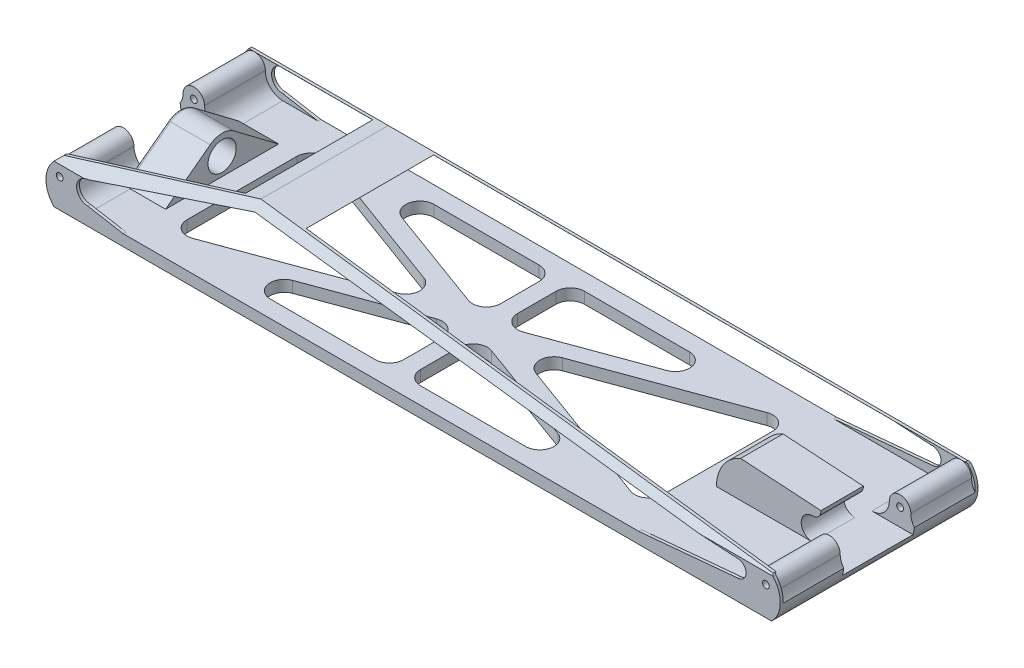
from build123d import *
from build123d.topology import SkipClean

# Parameters (mm, degrees)
SKETCH1_R                = 1.2
BOSS_EXTRUDE1_DEPTH      = 35
SKETCH2_W                = 25
SKETCH2_H                = 10
CUT_EXTRUDE1_DEPTH       = 273.618781451
BOSS_EXTRUDE2_DEPTH      = 7.5
SKETCH4_W                = 17.5
SKETCH4_H                = 25
CUT_EXTRUDE2_DEPTH       = 273.618781451
BOSS_EXTRUDE3_START      = 17.5
BOSS_EXTRUDE3_DEPTH      = 15
CUT_EXTRUDE7_DEPTH       = 273.618781451
FILLET8_R                = 5
FILLET9_R                = 1
BOSS_EXTRUDE4_DEPTH      = 270
CUT_EXTRUDE8_DEPTH       = 274.55025464
CUT_EXTRUDE8_DEPTH_BACK  = 274.55025464
CUT_EXTRUDE11_DEPTH      = 274.55025464
CUT_EXTRUDE11_DEPTH_BACK = 274.55025464
CUT_EXTRUDE9_DEPTH       = 276.428741807
CUT_EXTRUDE9_DEPTH_BACK  = 276.428741807
SKETCH19_R               = 1.2
CUT_EXTRUDE10_DEPTH      = 276.428741807
CUT_EXTRUDE10_DEPTH_BACK = 276.428741807
SKETCH21_R               = 1.2
CHAMFER1_SIZE            = 8
CHAMFER1_SIZE_2          = 9.946012797
CHAMFER1_SIZE_3          = 8.548617227
CHAMFER2_SIZE            = 8
CUT_EXTRUDE13_START      = -10.925683
CUT_EXTRUDE13_DEPTH      = 10.925683
CUT_EXTRUDE14_DEPTH      = 15
FILLET10_R               = 10


# Some blends are built 0.0001 mm under size
with BuildPart() as part:
    # Sketch1 → Boss-Extrude1 (new, symmetric)
    with BuildSketch(Plane.XY):
        with BuildLine():
            Line((0, 0), (270, 0))
            Line((270, 0), (270, 4))
            ThreePointArc((270, 4), (265.615937957, 5.815937957), (263.8, 10.2))
            ThreePointArc((263.8, 10.2), (260, 14), (256.2, 10.2))
            ThreePointArc((256.2, 10.2), (254.384062043, 5.815937957), (250, 4))
            Line((250, 4), (20, 4))
            ThreePointArc((20, 4), (15.615937957, 5.815937957), (13.8, 10.2))
            ThreePointArc((13.8, 10.2), (10, 14), (6.2, 10.2))
            ThreePointArc((6.2, 10.2), (4.384062043, 5.815937957), (0, 4))
            Line((0, 4), (0, 0))
        make_face()
        with Locations((10, 10.2)):
            Circle(SKETCH1_R, mode=Mode.SUBTRACT)
        with Locations((260, 10.2)):
            Circle(SKETCH1_R, mode=Mode.SUBTRACT)
    extrude(amount=BOSS_EXTRUDE1_DEPTH, both=True)

    # Sketch2 → Cut-Extrude1 (cut, through all)
    with BuildSketch(Plane(origin=(0, 0, 0), x_dir=(0, 0, -1), z_dir=(1, 0, 0))):
        with Locations((0, 9)):
            Rectangle(SKETCH2_W, SKETCH2_H)
    extrude(amount=CUT_EXTRUDE1_DEPTH, mode=Mode.SUBTRACT)

    # Sketch3 → Boss-Extrude2 (add, symmetric)
    with BuildSketch(Plane.XY):
        with BuildLine():
            Line((249, 18), (229, 18))
            ThreePointArc((229, 18), (219.100505063, 13.899494937), (215, 4))
            Line((215, 4), (249, 4))
            ThreePointArc((249, 4), (245, 8), (249, 12))
            ThreePointArc((249, 12), (252, 15), (249, 18))
        make_face()
    extrude(amount=BOSS_EXTRUDE2_DEPTH, both=True)

    # Sketch4 → Cut-Extrude2 (cut, through all)
    with BuildSketch(Plane(origin=(0, 4, 0), x_dir=(1, 0, 0), z_dir=(0, 1, 0))):
        with Locations((8.75, 0)):
            Rectangle(SKETCH4_W, SKETCH4_H)
    extrude(amount=-CUT_EXTRUDE2_DEPTH, mode=Mode.SUBTRACT)

    # Sketch6 → Boss-Extrude3 (add)
    with BuildSketch(Plane(origin=(0, 0, 0), x_dir=(0, 0, -1), z_dir=(1, 0, 0)).offset(BOSS_EXTRUDE3_START)):
        with BuildLine():
            Line((-15.013439976, 4), (-3.05122926, 4))
            ThreePointArc((-3.05122926, 4), (-5.860894332, 6.472478918), (-6.995136661, 10.039110964))
            Line((-6.995136661, 10.039110964), (-15.013439976, 4))
        make_face()
        with BuildLine():
            Line((-3.05122926, 4), (0, 4))
            Line((0, 4), (0, 5.3))
            ThreePointArc((0, 5.3), (-5, 10.3), (0, 15.3))
            Line((0, 15.3), (0, 17.3))
            ThreePointArc((0, 17.3), (-2.220310268, 16.938540677), (-4.211320008, 15.89149209))
            Line((-4.211320008, 15.89149209), (-20, 4))
            Line((-20, 4), (-15.013439976, 4))
            Line((-15.013439976, 4), (-6.995136661, 10.039110964))
            ThreePointArc((-6.995136661, 10.039110964), (-5.860894332, 6.472478918), (-3.05122926, 4))
        make_face()
        with BuildLine():
            Line((0, 5.3), (0, 4))
            Line((0, 4), (3.05122926, 4))
            ThreePointArc((3.05122926, 4), (5.860894332, 6.472478918), (6.995136661, 10.039110964))
            Line((6.995136661, 10.039110964), (15.013439976, 4))
            Line((15.013439976, 4), (20, 4))
            Line((20, 4), (4.211320008, 15.89149209))
            ThreePointArc((4.211320008, 15.89149209), (2.220310268, 16.938540677), (0, 17.3))
            Line((0, 17.3), (0, 15.3))
            ThreePointArc((0, 15.3), (3.535533906, 13.835533906), (5, 10.3))
            ThreePointArc((5, 10.3), (3.535533906, 6.764466094), (0, 5.3))
        make_face()
        with BuildLine():
            ThreePointArc((6.995136661, 10.039110964), (5.860894332, 6.472478918), (3.05122926, 4))
            Line((3.05122926, 4), (15.013439976, 4))
            Line((15.013439976, 4), (6.995136661, 10.039110964))
        make_face()
    extrude(amount=BOSS_EXTRUDE3_DEPTH)

    # Sketch12 → Cut-Extrude7 (cut, through all)
    with BuildSketch(Plane(origin=(0, 4, 0), x_dir=(1, 0, 0), z_dir=(0, 1, 0))):
        Polygon((50.365488341, -29), (120.75, -29), (120.75, -3.195266211), align=None)
        Polygon((39.5, -26.593029124), (112.034651346, 0), (39.5, 26.593029124), align=None)
        Polygon((120.75, 3.195266211), (120.75, 29), (50.365488341, 29), align=None)
        Polygon((126.75, 29), (126.75, 3.195266211), (197.134511659, 29), align=None)
        Polygon((135.465348654, 0), (208, -26.593029124), (208, 26.593029124), align=None)
        Polygon((126.75, -29), (197.134511659, -29), (126.75, -3.195266211), align=None)
    extrude(amount=-CUT_EXTRUDE7_DEPTH, mode=Mode.SUBTRACT)

    # Fillet8
    fillet8_edges = [part.edges().sort_by_distance(p)[0] for p in [
        (50.365488341, 2, -29),
        (120.75, 2, -29),
        (120.75, 2, -3.195266211),
        (39.5, 2, 26.593029124),
        (39.5, 2, -26.593029124),
        (112.034651346, 2, 0),
        (208, 2, 26.593029124),
        (135.465348654, 2, 0),
        (208, 2, -26.593029124),
        (126.75, 2, -29),
        (197.134511659, 2, -29),
        (126.75, 2, -3.195266211),
        (126.75, 2, 29),
        (126.75, 2, 3.195266211),
        (197.134511659, 2, 29),
        (50.365488341, 2, 29),
        (120.75, 2, 3.195266211),
        (120.75, 2, 29),
    ]]
    fillet(fillet8_edges, radius=FILLET8_R)

    # Fillet9
    fillet9_edges = [part.edges().sort_by_distance(p)[0] for p in [
        (17.5, 10.208934454, -11.756217096),
        (17.5, 10.208934454, 11.756217096),
        (17.5, 17.3, 0),
    ]]
    fillet(fillet9_edges, radius=FILLET9_R)

    # Sketch14 → Boss-Extrude4 (add, through all)
    with BuildSketch(Plane(origin=(0, 0, 0), x_dir=(0, 0, -1), z_dir=(1, 0, 0))):
        Polygon((-35, 14), (-35, 0), (-34, 0), (-34, 14), (-22.54020479, 25.546973716), (22.54020479, 25.546973716), (34, 14), (34, 0), (35, 0), (35, 14), (22.54020479, 26.546973716), (-22.54020479, 26.546973716), align=None)
    extrude(amount=BOSS_EXTRUDE4_DEPTH)

    # Sketch16 → Cut-Extrude8 (cut, two sides: drawn at the far end of the back side and taken through both)
    with BuildSketch(Plane.XY.offset(-CUT_EXTRUDE8_DEPTH_BACK)):
        Polygon((0, 26.546973716), (68.792545546, 26.546973716), (0, 14), align=None)
        Polygon((68.792545546, 26.546973716), (270, 14), (270, 26.546973716), align=None)
    extrude(amount=CUT_EXTRUDE8_DEPTH + CUT_EXTRUDE8_DEPTH_BACK, mode=Mode.SUBTRACT)

    # Sketch24 → Cut-Extrude11 (cut, two sides: drawn at the far end of the back side and taken through both)
    with BuildSketch(Plane.XY.offset(-CUT_EXTRUDE11_DEPTH_BACK)):
        with BuildLine():
            Line((32.5, 4), (32.5, 16))
            Line((32.5, 16), (69.185468124, 24.001191397))
            Line((69.185468124, 24.001191397), (218.863454759, 13.656627288))
            ThreePointArc((218.863454759, 13.656627288), (216.001699469, 9.200402226), (215, 4))
            Line((215, 4), (32.5, 4))
        make_face()
    extrude(amount=CUT_EXTRUDE11_DEPTH + CUT_EXTRUDE11_DEPTH_BACK, mode=Mode.SUBTRACT)

    # Sketch19 → Cut-Extrude9 (cut, two sides: drawn at the far end of the back side and taken through both)
    with SkipClean():  # the faces are left unmerged after this step: merging them gives an invalid solid
        with BuildSketch(Plane(origin=(0, 0, 12.5), x_dir=(-1, 0, 0), z_dir=(0, 0, -1)).offset(-CUT_EXTRUDE9_DEPTH_BACK)):
            with Locations((-260, 10.2)):
                Circle(SKETCH19_R)
        extrude(amount=CUT_EXTRUDE9_DEPTH + CUT_EXTRUDE9_DEPTH_BACK, mode=Mode.SUBTRACT)
    add(part.part.scale(1), mode=Mode.REPLACE)  # the faces are merged on a copy

    # Sketch21 → Cut-Extrude10 (cut, two sides: drawn at the far end of the back side and taken through both)
    with BuildSketch(Plane.XY.offset(-12.5).offset(-CUT_EXTRUDE10_DEPTH_BACK)):
        with Locations(Location((10, 10.2, 0), (0, 0, 180))):
            Circle(SKETCH21_R)
    extrude(amount=CUT_EXTRUDE10_DEPTH + CUT_EXTRUDE10_DEPTH_BACK, mode=Mode.SUBTRACT)

    # Chamfer1
    # the kernel refuses this chamfer: 9.946012797, 8.548617227, 8 mm, written as the material it takes off along each edge
    with BuildSketch(Plane(origin=(0, 14, -60.689326847), x_dir=(-0.03395034804691947, -0.9994235207695948, 0), z_dir=(0, 0, 1)), Plane(origin=(0, 14, 8.310673153), x_dir=(-0.03395034804691947, -0.9994235207695948, 0), z_dir=(0, 0, 1))) as chamfer1_piece_1:
        Polygon((CHAMFER1_SIZE * 0.99942352077, CHAMFER1_SIZE * 0.0339503480469), (-CHAMFER1_SIZE_2 * 0.212724513091, CHAMFER1_SIZE_2 * 0.977112215423), (0, 0), align=None)
    extrude(amount=52.378653694, mode=Mode.SUBTRACT)
    with BuildSketch(Plane(origin=(270, 0, -55.573463904), x_dir=(-0.9996219169112968, -0.027495876610586292, 0), z_dir=(0, 0, 1))) as chamfer1_piece_2:
        Polygon((CHAMFER1_SIZE * 0.999621916911, -CHAMFER1_SIZE * 0.0274958766106), (-CHAMFER1_SIZE * 0.0274958766106, -CHAMFER1_SIZE * 0.999621916911), (0, 0), align=None)
    extrude(amount=111.146927807, mode=Mode.SUBTRACT)
    with BuildSketch(Plane(origin=(270, 14, -57.019738367), x_dir=(0.025689924898951687, -0.9996699594159495, 0), z_dir=(0, 0, 1)), Plane(origin=(270, 14, 11.980261633), x_dir=(0.025689924898951687, -0.9996699594159495, 0), z_dir=(0, 0, 1))) as chamfer1_piece_3:
        Polygon((CHAMFER1_SIZE_3 * 0.99966995936, -CHAMFER1_SIZE_3 * 0.0256899248975), (-CHAMFER1_SIZE * 0.0878570846319, -CHAMFER1_SIZE * 0.996133089843), (0, 0), align=None)
    extrude(amount=45.039476735, mode=Mode.SUBTRACT)

    # Chamfer2
    # the kernel refuses this chamfer: 8 mm, written as the material it takes off along each edge
    with BuildSketch(Plane(origin=(0, 0, 8.073463904), x_dir=(0.9996219169112968, -0.02749587661058637, 0), z_dir=(0, 0, -1)), Plane(origin=(0, 0, 55.573463904), x_dir=(0.9996219169112968, -0.02749587661058637, 0), z_dir=(0, 0, -1))) as chamfer2_piece_1:
        Polygon((CHAMFER2_SIZE * 0.999621916911, -CHAMFER2_SIZE * 0.0274958766106), (-CHAMFER2_SIZE * 0.0274958766106, -CHAMFER2_SIZE * 0.999621916911), (0, 0), align=None)
    extrude(amount=63.646927807, mode=Mode.SUBTRACT)

    # Sketch25 → Cut-Extrude13 (cut)
    with BuildSketch(Plane.XY.offset(35).offset(CUT_EXTRUDE13_START)):
        with BuildLine():
            Line((69.185468124, 24.001191397), (20, 14.2))
            ThreePointArc((20, 14.2), (19.367544468, 14.149683532), (18.7510004, 14))
            Line((18.7510004, 14), (32.5, 14))
            Line((32.5, 14), (32.5, 4))
            Line((32.5, 4), (69.185468124, 24.001191397))
        make_face()
        with BuildLine():
            Line((32.5, 14), (18.7510004, 14))
            ThreePointArc((18.7510004, 14), (16.050316468, 9.567544468), (20, 6.2))
            Line((20, 6.2), (32.5, 4))
            Line((32.5, 4), (32.5, 14))
        make_face()
        with BuildLine():
            Line((236.607808325, 14), (69.185468124, 24.001191397))
            Line((69.185468124, 24.001191397), (215, 4))
            ThreePointArc((215, 4), (216.001699469, 9.200402226), (218.863454759, 13.656627288))
            Line((218.863454759, 13.656627288), (213.895112386, 14))
            Line((213.895112386, 14), (236.607808325, 14))
        make_face()
        with BuildLine():
            Line((250, 13.2), (236.607808325, 14))
            Line((236.607808325, 14), (213.895112386, 14))
            Line((213.895112386, 14), (218.863454759, 13.656627288))
            ThreePointArc((218.863454759, 13.656627288), (216.001699469, 9.200402226), (215, 4))
            Line((215, 4), (250, 7.2))
            ThreePointArc((250, 7.2), (253, 10.2), (250, 13.2))
        make_face()
    extrude(amount=CUT_EXTRUDE13_DEPTH, mode=Mode.SUBTRACT)

    # Sketch26 → Cut-Extrude14 (cut)
    with BuildSketch(Plane(origin=(0, 0, -35), x_dir=(-1, 0, 0), z_dir=(0, 0, -1))):
        with BuildLine():
            Line((-32.5, 14), (-32.5, 4))
            Line((-32.5, 4), (-20, 6.2))
            ThreePointArc((-20, 6.2), (-16.050316468, 9.567544468), (-18.7510004, 14))
            Line((-18.7510004, 14), (-32.5, 14))
        make_face()
        with BuildLine():
            Line((-20, 14.2), (-69.185468124, 24.001191397))
            Line((-69.185468124, 24.001191397), (-32.5, 4))
            Line((-32.5, 4), (-32.5, 14))
            Line((-32.5, 14), (-18.7510004, 14))
            ThreePointArc((-18.7510004, 14), (-19.367544468, 14.149683532), (-20, 14.2))
        make_face()
        with BuildLine():
            Line((-236.100536944, 14), (-249.701168083, 13.185079477))
            ThreePointArc((-249.701168083, 13.185079477), (-252.996267547, 10.349602086), (-250, 7.2))
            Line((-250, 7.2), (-215, 4))
            ThreePointArc((-215, 4), (-216.001699469, 9.200402226), (-218.863454759, 13.656627288))
            Line((-218.863454759, 13.656627288), (-213.895112386, 14))
            Line((-213.895112386, 14), (-236.100536944, 14))
        make_face()
        with BuildLine():
            Line((-69.185468124, 24.001191397), (-236.100536944, 14))
            Line((-236.100536944, 14), (-213.895112386, 14))
            Line((-213.895112386, 14), (-218.863454759, 13.656627288))
            ThreePointArc((-218.863454759, 13.656627288), (-216.001699469, 9.200402226), (-215, 4))
            Line((-215, 4), (-69.185468124, 24.001191397))
        make_face()
    extrude(amount=-CUT_EXTRUDE14_DEPTH, mode=Mode.SUBTRACT)

    # Fillet10
    fillet10_edges = [part.edges().sort_by_distance(p)[0] for p in [
        (268.805155225, 6.805155225, 34.5),
    ]]
    fillet(fillet10_edges, radius=FILLET10_R - 0.0001)  # a hair under: the kernel refuses the full size
    # the kernel refuses this fillet: 10 mm, written as the material it takes off along each edge
    with BuildSketch(Plane(origin=(1, 7, 60), x_dir=(0.707106781186265, -0.7071067811868301, 0), z_dir=(0, 0, -1))) as fillet10_2_piece_1:
        with BuildLine():
            CenterArc((FILLET10_R, -FILLET10_R), FILLET10_R, 90, 90)
            Line((0, -FILLET10_R), (-FILLET10_R * 0.0200000000005, -FILLET10_R))
            Line((-FILLET10_R * 0.0200000000005, -FILLET10_R), (-FILLET10_R * 0.02, FILLET10_R * 0.02))
            Line((-FILLET10_R * 0.02, FILLET10_R * 0.02), (FILLET10_R, FILLET10_R * 0.02))
            Line((FILLET10_R, FILLET10_R * 0.02), (FILLET10_R, 0))
        make_face()
    extrude(amount=51, mode=Mode.SUBTRACT)
    # the kernel refuses this fillet: 10 mm, written as the material it takes off along each edge
    with BuildSketch(Plane(origin=(1, 7, -9), x_dir=(0.707106781186265, -0.7071067811868301, 0), z_dir=(0, 0, -1))) as fillet10_3_piece_1:
        with BuildLine():
            CenterArc((FILLET10_R, -FILLET10_R), FILLET10_R, 90, 90)
            Line((0, -FILLET10_R), (-FILLET10_R * 0.0200000000005, -FILLET10_R))
            Line((-FILLET10_R * 0.0200000000005, -FILLET10_R), (-FILLET10_R * 0.02, FILLET10_R * 0.02))
            Line((-FILLET10_R * 0.02, FILLET10_R * 0.02), (FILLET10_R, FILLET10_R * 0.02))
            Line((FILLET10_R, FILLET10_R * 0.02), (FILLET10_R, 0))
        make_face()
    extrude(amount=51, mode=Mode.SUBTRACT)


solid = part.part
